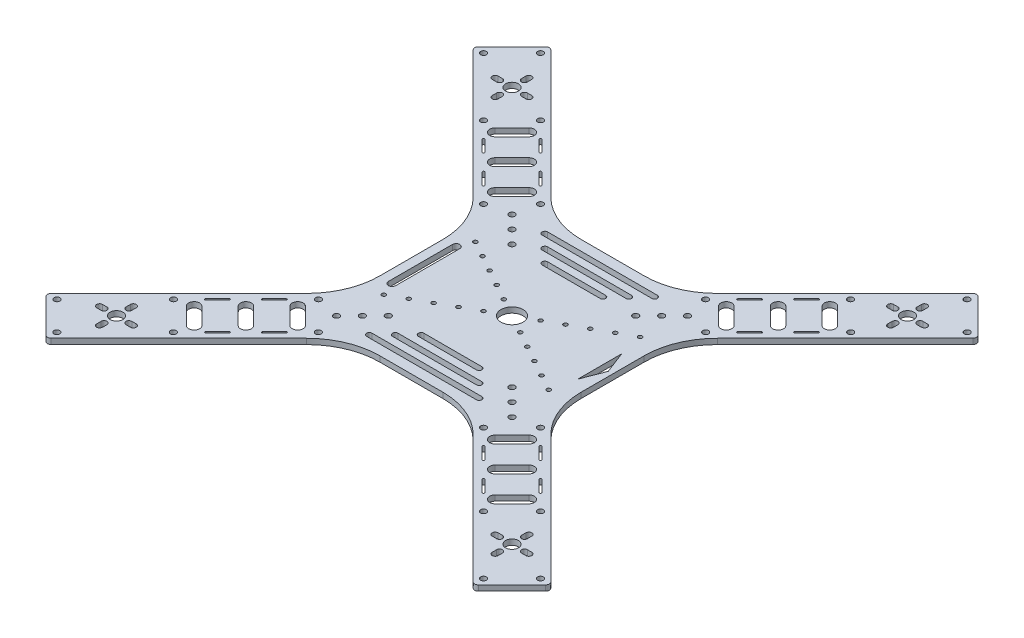
from build123d import *

# Parameters (mm, degrees)
SKETCH_1_R      = 1.6
SKETCH_1_R_2    = 3.5
SKETCH_1_R_3    = 1.1
SKETCH_1_R_4    = 6
EXTRUDE_2_DEPTH = 3
FILLET_1_R      = 2
FILLET_2_R      = 2


with BuildPart() as part:
    # 草图1 → 凸台-拉伸2 (new body)
    with BuildSketch(Plane(origin=(0, 0, 0), x_dir=(1, 0, 0), z_dir=(0, 1, 0))):
        with BuildLine():
            Line((17.218254069, 55), (-17.218254069, 55))
            ThreePointArc((-17.218254069, 55), (-32.525591364, 58.0448187), (-45.502525317, 66.715728753))
            Line((-45.502525317, 66.715728753), (-116.672618896, 137.885822331))
            Line((-116.672618896, 137.885822331), (-137.885822331, 116.672618896))
            Line((-137.885822331, 116.672618896), (-66.715728753, 45.502525317))
            ThreePointArc((-66.715728753, 45.502525317), (-58.0448187, 32.525591364), (-55, 17.218254069))
            Line((-55, 17.218254069), (-55, -17.218254069))
            ThreePointArc((-55, -17.218254069), (-58.0448187, -32.525591364), (-66.715728753, -45.502525317))
            Line((-66.715728753, -45.502525317), (-137.885822331, -116.672618896))
            Line((-137.885822331, -116.672618896), (-116.672618896, -137.885822331))
            Line((-116.672618896, -137.885822331), (-45.502525317, -66.715728753))
            ThreePointArc((-45.502525317, -66.715728753), (-32.525591364, -58.0448187), (-17.218254069, -55))
            Line((-17.218254069, -55), (17.218254069, -55))
            ThreePointArc((17.218254069, -55), (32.525591364, -58.0448187), (45.502525317, -66.715728753))
            Line((45.502525317, -66.715728753), (116.672618896, -137.885822331))
            Line((116.672618896, -137.885822331), (137.885822331, -116.672618896))
            Line((137.885822331, -116.672618896), (66.715728753, -45.502525317))
            ThreePointArc((66.715728753, -45.502525317), (58.0448187, -32.525591364), (55, -17.218254069))
            Line((55, -17.218254069), (55, 17.218254069))
            ThreePointArc((55, 17.218254069), (58.0448187, 32.525591364), (66.715728753, 45.502525317))
            Line((66.715728753, 45.502525317), (137.885822331, 116.672618896))
            Line((137.885822331, 116.672618896), (116.672618896, 137.885822331))
            Line((116.672618896, 137.885822331), (45.502525317, 66.715728753))
            ThreePointArc((45.502525317, 66.715728753), (32.525591364, 58.0448187), (17.218254069, 55))
        make_face()
        with Locations((-116.518289963, -132.074639149)):
            Circle(SKETCH_1_R, mode=Mode.SUBTRACT)
        with Locations((-132.074639149, -116.518289963)):
            Circle(SKETCH_1_R, mode=Mode.SUBTRACT)
        with BuildLine():
            ThreePointArc((-106.433008589, -117.233008589), (-108.033008589, -118.833008589), (-109.633008589, -117.233008589))
            Line((-109.633008589, -117.233008589), (-109.633008589, -114.833008589))
            ThreePointArc((-109.633008589, -114.833008589), (-108.033008589, -113.233008589), (-106.433008589, -114.833008589))
            Line((-106.433008589, -114.833008589), (-106.433008589, -117.233008589))
        make_face(mode=Mode.SUBTRACT)
        with BuildLine():
            ThreePointArc((-117.233008589, -109.633008589), (-118.833008589, -108.033008589), (-117.233008589, -106.433008589))
            Line((-117.233008589, -106.433008589), (-114.833008589, -106.433008589))
            ThreePointArc((-114.833008589, -106.433008589), (-113.233008589, -108.033008589), (-114.833008589, -109.633008589))
            Line((-114.833008589, -109.633008589), (-117.233008589, -109.633008589))
        make_face(mode=Mode.SUBTRACT)
        with Locations((-108.033008589, -108.033008589)):
            Circle(SKETCH_1_R_2, mode=Mode.SUBTRACT)
        with BuildLine():
            ThreePointArc((-98.833008589, -106.433008589), (-97.233008589, -108.033008589), (-98.833008589, -109.633008589))
            Line((-98.833008589, -109.633008589), (-101.233008589, -109.633008589))
            ThreePointArc((-101.233008589, -109.633008589), (-102.833008589, -108.033008589), (-101.233008589, -106.433008589))
            Line((-101.233008589, -106.433008589), (-98.833008589, -106.433008589))
        make_face(mode=Mode.SUBTRACT)
        with BuildLine():
            ThreePointArc((-109.633008589, -98.833008589), (-108.033008589, -97.233008589), (-106.433008589, -98.833008589))
            Line((-106.433008589, -98.833008589), (-106.433008589, -101.233008589))
            ThreePointArc((-106.433008589, -101.233008589), (-108.033008589, -102.833008589), (-109.633008589, -101.233008589))
            Line((-109.633008589, -101.233008589), (-109.633008589, -98.833008589))
        make_face(mode=Mode.SUBTRACT)
        with BuildLine():
            ThreePointArc((-80.102290732, -89.294678888), (-80.102290732, -93.537319575), (-84.344931419, -93.537319575))
            Line((-84.344931419, -93.537319575), (-93.537319575, -84.344931419))
            ThreePointArc((-93.537319575, -84.344931419), (-93.537319575, -80.102290732), (-89.294678888, -80.102290732))
            Line((-89.294678888, -80.102290732), (-80.102290732, -89.294678888))
        make_face(mode=Mode.SUBTRACT)
        with Locations((-84.69848481, -100.254833996)):
            Circle(SKETCH_1_R, mode=Mode.SUBTRACT)
        with BuildLine():
            Line((-76.213203436, -91.062445841), (-69.849242405, -84.69848481))
            ThreePointArc((-69.849242405, -84.69848481), (-69.142135624, -84.69848481), (-69.142135624, -85.405591591))
            Line((-69.142135624, -85.405591591), (-75.506096654, -91.769552622))
            ThreePointArc((-75.506096654, -91.769552622), (-76.213203436, -91.769552622), (-76.213203436, -91.062445841))
        make_face(mode=Mode.SUBTRACT)
        with Locations((-100.254833996, -84.69848481)):
            Circle(SKETCH_1_R, mode=Mode.SUBTRACT)
        with BuildLine():
            ThreePointArc((-85.405591591, -69.142135624), (-84.69848481, -69.142135624), (-84.69848481, -69.849242405))
            Line((-84.69848481, -69.849242405), (-91.06244584, -76.213203436))
            ThreePointArc((-91.06244584, -76.213203436), (-91.769552622, -76.213203436), (-91.769552622, -75.506096654))
            Line((-91.769552622, -75.506096654), (-85.405591591, -69.142135624))
        make_face(mode=Mode.SUBTRACT)
        with BuildLine():
            ThreePointArc((-65.960155108, -75.152543264), (-65.960155108, -79.395183951), (-70.202795796, -79.395183951))
            Line((-70.202795796, -79.395183951), (-79.395183951, -70.202795796))
            ThreePointArc((-79.395183951, -70.202795796), (-79.395183951, -65.960155108), (-75.152543264, -65.960155108))
            Line((-75.152543264, -65.960155108), (-65.960155108, -75.152543264))
        make_face(mode=Mode.SUBTRACT)
        with BuildLine():
            Line((-60.656854249, -75.506096654), (-54.292893219, -69.142135624))
            ThreePointArc((-54.292893219, -69.142135624), (-53.585786438, -69.142135624), (-53.585786438, -69.849242405))
            Line((-53.585786438, -69.849242405), (-59.949747468, -76.213203436))
            ThreePointArc((-59.949747468, -76.213203436), (-60.656854249, -76.213203436), (-60.656854249, -75.506096654))
        make_face(mode=Mode.SUBTRACT)
        with BuildLine():
            ThreePointArc((-69.849242405, -53.585786438), (-69.142135624, -53.585786438), (-69.142135624, -54.292893219))
            Line((-69.142135624, -54.292893219), (-75.506096654, -60.656854249))
            ThreePointArc((-75.506096654, -60.656854249), (-76.213203436, -60.656854249), (-76.213203436, -59.949747468))
            Line((-76.213203436, -59.949747468), (-69.849242405, -53.585786438))
        make_face(mode=Mode.SUBTRACT)
        with BuildLine():
            ThreePointArc((-51.818019485, -61.01040764), (-51.818019485, -65.253048327), (-56.060660172, -65.253048327))
            Line((-56.060660172, -65.253048327), (-65.253048327, -56.060660172))
            ThreePointArc((-65.253048327, -56.060660172), (-65.253048327, -51.818019485), (-61.01040764, -51.818019485))
            Line((-61.01040764, -51.818019485), (-56.414213562, -56.414213562))
            Line((-56.414213562, -56.414213562), (-51.818019485, -61.01040764))
        make_face(mode=Mode.SUBTRACT)
        with Locations((-45.100505063, -60.656854249)):
            Circle(SKETCH_1_R, mode=Mode.SUBTRACT)
        with Locations((-60.656854249, -45.100505063)):
            Circle(SKETCH_1_R, mode=Mode.SUBTRACT)
        with Locations((-47.928932188, -47.928932188)):
            Circle(SKETCH_1_R, mode=Mode.SUBTRACT)
        with Locations((-40.857864376, -40.857864376)):
            Circle(SKETCH_1_R, mode=Mode.SUBTRACT)
        with Locations((-44.999999799, -25)):
            Circle(SKETCH_1_R_3, mode=Mode.SUBTRACT)
        with Locations((-36.258427038, -20.143570688)):
            Circle(SKETCH_1_R_3, mode=Mode.SUBTRACT)
        with BuildLine():
            ThreePointArc((-50.041675599, 17.5), (-48.041675599, 19.5), (-46.041675599, 17.5))
            Line((-46.041675599, 17.5), (-46.041675599, 0))
            Line((-46.041675599, 0), (-46.041675599, -17.5))
            ThreePointArc((-46.041675599, -17.5), (-48.041675599, -19.5), (-50.041675599, -17.5))
            Line((-50.041675599, -17.5), (-50.041675599, 17.5))
        make_face(mode=Mode.SUBTRACT)
        with Locations((-33.786796564, -33.786796564)):
            Circle(SKETCH_1_R, mode=Mode.SUBTRACT)
        with Locations((-27.516854277, -15.287141376)):
            Circle(SKETCH_1_R_3, mode=Mode.SUBTRACT)
        with Locations((-18.775281516, -10.430712065)):
            Circle(SKETCH_1_R_3, mode=Mode.SUBTRACT)
        with Locations((-10.033708754, -5.574282753)):
            Circle(SKETCH_1_R_3, mode=Mode.SUBTRACT)
        with BuildLine():
            ThreePointArc((53.585786438, -69.849242405), (53.585786438, -69.142135624), (54.292893219, -69.142135624))
            Line((54.292893219, -69.142135624), (60.656854249, -75.506096654))
            ThreePointArc((60.656854249, -75.506096654), (60.656854249, -76.213203436), (59.949747468, -76.213203436))
            Line((59.949747468, -76.213203436), (53.585786438, -69.849242405))
        make_face(mode=Mode.SUBTRACT)
        with BuildLine():
            ThreePointArc((98.833008589, -109.633008589), (97.233008589, -108.033008589), (98.833008589, -106.433008589))
            Line((98.833008589, -106.433008589), (101.233008589, -106.433008589))
            ThreePointArc((101.233008589, -106.433008589), (102.833008589, -108.033008589), (101.233008589, -109.633008589))
            Line((101.233008589, -109.633008589), (98.833008589, -109.633008589))
        make_face(mode=Mode.SUBTRACT)
        with Locations((116.518289963, -132.074639149)):
            Circle(SKETCH_1_R, mode=Mode.SUBTRACT)
        with BuildLine():
            ThreePointArc((109.633008589, -117.233008589), (108.033008589, -118.833008589), (106.433008589, -117.233008589))
            Line((106.433008589, -117.233008589), (106.433008589, -114.833008589))
            ThreePointArc((106.433008589, -114.833008589), (108.033008589, -113.233008589), (109.633008589, -114.833008589))
            Line((109.633008589, -114.833008589), (109.633008589, -117.233008589))
        make_face(mode=Mode.SUBTRACT)
        with Locations((108.033008589, -108.033008589)):
            Circle(SKETCH_1_R_2, mode=Mode.SUBTRACT)
        with BuildLine():
            ThreePointArc((117.233008589, -106.433008589), (118.833008589, -108.033008589), (117.233008589, -109.633008589))
            Line((117.233008589, -109.633008589), (114.833008589, -109.633008589))
            ThreePointArc((114.833008589, -109.633008589), (113.233008589, -108.033008589), (114.833008589, -106.433008589))
            Line((114.833008589, -106.433008589), (117.233008589, -106.433008589))
        make_face(mode=Mode.SUBTRACT)
        with Locations((132.074639149, -116.518289963)):
            Circle(SKETCH_1_R, mode=Mode.SUBTRACT)
        with Locations((84.69848481, -100.254833996)):
            Circle(SKETCH_1_R, mode=Mode.SUBTRACT)
        with BuildLine():
            ThreePointArc((69.142135624, -85.405591591), (69.142135624, -84.69848481), (69.849242405, -84.69848481))
            Line((69.849242405, -84.69848481), (76.213203436, -91.062445841))
            ThreePointArc((76.213203436, -91.062445841), (76.213203436, -91.769552622), (75.506096654, -91.769552622))
            Line((75.506096654, -91.769552622), (69.142135624, -85.405591591))
        make_face(mode=Mode.SUBTRACT)
        with BuildLine():
            ThreePointArc((89.294678888, -80.102290732), (93.537319575, -80.102290732), (93.537319575, -84.344931419))
            Line((93.537319575, -84.344931419), (84.344931419, -93.537319575))
            ThreePointArc((84.344931419, -93.537319575), (80.102290732, -93.537319575), (80.102290732, -89.294678888))
            Line((80.102290732, -89.294678888), (89.294678888, -80.102290732))
        make_face(mode=Mode.SUBTRACT)
        with BuildLine():
            ThreePointArc((75.152543264, -65.960155108), (79.395183951, -65.960155108), (79.395183951, -70.202795796))
            Line((79.395183951, -70.202795796), (70.202795796, -79.395183951))
            ThreePointArc((70.202795796, -79.395183951), (65.960155108, -79.395183951), (65.960155108, -75.152543264))
            Line((65.960155108, -75.152543264), (75.152543264, -65.960155108))
        make_face(mode=Mode.SUBTRACT)
        with Locations((100.254833996, -84.69848481)):
            Circle(SKETCH_1_R, mode=Mode.SUBTRACT)
        with BuildLine():
            Line((91.062445841, -76.213203436), (84.69848481, -69.849242405))
            ThreePointArc((84.69848481, -69.849242405), (84.69848481, -69.142135624), (85.405591591, -69.142135624))
            Line((85.405591591, -69.142135624), (91.769552622, -75.506096654))
            ThreePointArc((91.769552622, -75.506096654), (91.769552622, -76.213203436), (91.062445841, -76.213203436))
        make_face(mode=Mode.SUBTRACT)
        with BuildLine():
            ThreePointArc((106.433008589, -98.833008589), (108.033008589, -97.233008589), (109.633008589, -98.833008589))
            Line((109.633008589, -98.833008589), (109.633008589, -101.233008589))
            ThreePointArc((109.633008589, -101.233008589), (108.033008589, -102.833008589), (106.433008589, -101.233008589))
            Line((106.433008589, -101.233008589), (106.433008589, -98.833008589))
        make_face(mode=Mode.SUBTRACT)
        with BuildLine():
            Line((30, -49.428932188), (-30, -49.428932188))
            ThreePointArc((-30, -49.428932188), (-31.5, -47.928932188), (-30, -46.428932188))
            Line((-30, -46.428932188), (30, -46.428932188))
            ThreePointArc((30, -46.428932188), (31.5, -47.928932188), (30, -49.428932188))
        make_face(mode=Mode.SUBTRACT)
        with BuildLine():
            Line((22.928932188, -42.357864376), (-22.928932188, -42.357864376))
            ThreePointArc((-22.928932188, -42.357864376), (-24.428932188, -40.857864376), (-22.928932188, -39.357864376))
            Line((-22.928932188, -39.357864376), (22.928932188, -39.357864376))
            ThreePointArc((22.928932188, -39.357864376), (24.428932188, -40.857864376), (22.928932188, -42.357864376))
        make_face(mode=Mode.SUBTRACT)
        with Locations((45.100505063, -60.656854249)):
            Circle(SKETCH_1_R, mode=Mode.SUBTRACT)
        with BuildLine():
            ThreePointArc((61.01040764, -51.818019485), (65.253048327, -51.818019485), (65.253048327, -56.060660172))
            Line((65.253048327, -56.060660172), (56.060660172, -65.253048327))
            ThreePointArc((56.060660172, -65.253048327), (51.818019485, -65.253048327), (51.818019485, -61.01040764))
            Line((51.818019485, -61.01040764), (56.414213562, -56.414213562))
            Line((56.414213562, -56.414213562), (61.01040764, -51.818019485))
        make_face(mode=Mode.SUBTRACT)
        with Locations((47.928932188, -47.928932188)):
            Circle(SKETCH_1_R, mode=Mode.SUBTRACT)
        with Locations((40.857864376, -40.857864376)):
            Circle(SKETCH_1_R, mode=Mode.SUBTRACT)
        with Locations((60.656854249, -45.100505063)):
            Circle(SKETCH_1_R, mode=Mode.SUBTRACT)
        with BuildLine():
            Line((15.857864376, -35.286796564), (-15.857864376, -35.286796564))
            ThreePointArc((-15.857864376, -35.286796564), (-17.357864376, -33.786796564), (-15.857864376, -32.286796564))
            Line((-15.857864376, -32.286796564), (15.857864376, -32.286796564))
            ThreePointArc((15.857864376, -32.286796564), (17.357864376, -33.786796564), (15.857864376, -35.286796564))
        make_face(mode=Mode.SUBTRACT)
        with Locations((33.786796564, -33.786796564)):
            Circle(SKETCH_1_R, mode=Mode.SUBTRACT)
        Circle(SKETCH_1_R_4, mode=Mode.SUBTRACT)
        with Locations((10.033709156, -5.574282753)):
            Circle(SKETCH_1_R_3, mode=Mode.SUBTRACT)
        with Locations((18.775281917, -10.430712065)):
            Circle(SKETCH_1_R_3, mode=Mode.SUBTRACT)
        with Locations((27.516854678, -15.287141376)):
            Circle(SKETCH_1_R_3, mode=Mode.SUBTRACT)
        with Locations((36.258427439, -20.143570688)):
            Circle(SKETCH_1_R_3, mode=Mode.SUBTRACT)
        with Locations((45.000000201, -25)):
            Circle(SKETCH_1_R_3, mode=Mode.SUBTRACT)
        Polygon((47.928932188, -12), (47.928932188, 12), (52.541676, 0), align=None, mode=Mode.SUBTRACT)
        with BuildLine():
            Line((75.506096654, -60.656854249), (69.142135624, -54.292893219))
            ThreePointArc((69.142135624, -54.292893219), (69.142135624, -53.585786438), (69.849242405, -53.585786438))
            Line((69.849242405, -53.585786438), (76.213203436, -59.949747468))
            ThreePointArc((76.213203436, -59.949747468), (76.213203436, -60.656854249), (75.506096654, -60.656854249))
        make_face(mode=Mode.SUBTRACT)
        with BuildLine():
            Line((-75.506096654, 60.656854249), (-69.142135624, 54.292893219))
            ThreePointArc((-69.142135624, 54.292893219), (-69.142135624, 53.585786438), (-69.849242405, 53.585786438))
            Line((-69.849242405, 53.585786438), (-76.213203436, 59.949747468))
            ThreePointArc((-76.213203436, 59.949747468), (-76.213203436, 60.656854249), (-75.506096654, 60.656854249))
        make_face(mode=Mode.SUBTRACT)
        with Locations((-44.999999799, 25)):
            Circle(SKETCH_1_R_3, mode=Mode.SUBTRACT)
        with Locations((-36.258427038, 20.143570688)):
            Circle(SKETCH_1_R_3, mode=Mode.SUBTRACT)
        with Locations((-27.516854277, 15.287141376)):
            Circle(SKETCH_1_R_3, mode=Mode.SUBTRACT)
        with Locations((-18.775281516, 10.430712065)):
            Circle(SKETCH_1_R_3, mode=Mode.SUBTRACT)
        with Locations((-10.033708754, 5.574282753)):
            Circle(SKETCH_1_R_3, mode=Mode.SUBTRACT)
        with Locations((-33.786796564, 33.786796564)):
            Circle(SKETCH_1_R, mode=Mode.SUBTRACT)
        with Locations((-60.656854249, 45.100505063)):
            Circle(SKETCH_1_R, mode=Mode.SUBTRACT)
        with Locations((-40.857864376, 40.857864376)):
            Circle(SKETCH_1_R, mode=Mode.SUBTRACT)
        with Locations((-47.928932188, 47.928932188)):
            Circle(SKETCH_1_R, mode=Mode.SUBTRACT)
        with BuildLine():
            ThreePointArc((-61.01040764, 51.818019485), (-65.253048327, 51.818019485), (-65.253048327, 56.060660172))
            Line((-65.253048327, 56.060660172), (-56.060660172, 65.253048327))
            ThreePointArc((-56.060660172, 65.253048327), (-51.818019485, 65.253048327), (-51.818019485, 61.01040764))
            Line((-51.818019485, 61.01040764), (-56.414213562, 56.414213562))
            Line((-56.414213562, 56.414213562), (-61.01040764, 51.818019485))
        make_face(mode=Mode.SUBTRACT)
        with Locations((-45.100505063, 60.656854249)):
            Circle(SKETCH_1_R, mode=Mode.SUBTRACT)
        with BuildLine():
            ThreePointArc((-106.433008589, 98.833008589), (-108.033008589, 97.233008589), (-109.633008589, 98.833008589))
            Line((-109.633008589, 98.833008589), (-109.633008589, 101.233008589))
            ThreePointArc((-109.633008589, 101.233008589), (-108.033008589, 102.833008589), (-106.433008589, 101.233008589))
            Line((-106.433008589, 101.233008589), (-106.433008589, 98.833008589))
        make_face(mode=Mode.SUBTRACT)
        with BuildLine():
            Line((-91.062445841, 76.213203436), (-84.69848481, 69.849242405))
            ThreePointArc((-84.69848481, 69.849242405), (-84.69848481, 69.142135624), (-85.405591591, 69.142135624))
            Line((-85.405591591, 69.142135624), (-91.769552622, 75.506096654))
            ThreePointArc((-91.769552622, 75.506096654), (-91.769552622, 76.213203436), (-91.062445841, 76.213203436))
        make_face(mode=Mode.SUBTRACT)
        with Locations((-100.254833996, 84.69848481)):
            Circle(SKETCH_1_R, mode=Mode.SUBTRACT)
        with BuildLine():
            ThreePointArc((-75.152543264, 65.960155108), (-79.395183951, 65.960155108), (-79.395183951, 70.202795796))
            Line((-79.395183951, 70.202795796), (-70.202795796, 79.395183951))
            ThreePointArc((-70.202795796, 79.395183951), (-65.960155108, 79.395183951), (-65.960155108, 75.152543264))
            Line((-65.960155108, 75.152543264), (-75.152543264, 65.960155108))
        make_face(mode=Mode.SUBTRACT)
        with BuildLine():
            ThreePointArc((-89.294678888, 80.102290732), (-93.537319575, 80.102290732), (-93.537319575, 84.344931419))
            Line((-93.537319575, 84.344931419), (-84.344931419, 93.537319575))
            ThreePointArc((-84.344931419, 93.537319575), (-80.102290732, 93.537319575), (-80.102290732, 89.294678888))
            Line((-80.102290732, 89.294678888), (-89.294678888, 80.102290732))
        make_face(mode=Mode.SUBTRACT)
        with BuildLine():
            ThreePointArc((-69.142135624, 85.405591591), (-69.142135624, 84.69848481), (-69.849242405, 84.69848481))
            Line((-69.849242405, 84.69848481), (-76.213203436, 91.062445841))
            ThreePointArc((-76.213203436, 91.062445841), (-76.213203436, 91.769552622), (-75.506096654, 91.769552622))
            Line((-75.506096654, 91.769552622), (-69.142135624, 85.405591591))
        make_face(mode=Mode.SUBTRACT)
        with Locations((-84.69848481, 100.254833996)):
            Circle(SKETCH_1_R, mode=Mode.SUBTRACT)
        with Locations((-132.074639149, 116.518289963)):
            Circle(SKETCH_1_R, mode=Mode.SUBTRACT)
        with BuildLine():
            ThreePointArc((-117.233008589, 106.433008589), (-118.833008589, 108.033008589), (-117.233008589, 109.633008589))
            Line((-117.233008589, 109.633008589), (-114.833008589, 109.633008589))
            ThreePointArc((-114.833008589, 109.633008589), (-113.233008589, 108.033008589), (-114.833008589, 106.433008589))
            Line((-114.833008589, 106.433008589), (-117.233008589, 106.433008589))
        make_face(mode=Mode.SUBTRACT)
        with Locations((-108.033008589, 108.033008589)):
            Circle(SKETCH_1_R_2, mode=Mode.SUBTRACT)
        with BuildLine():
            ThreePointArc((-109.633008589, 117.233008589), (-108.033008589, 118.833008589), (-106.433008589, 117.233008589))
            Line((-106.433008589, 117.233008589), (-106.433008589, 114.833008589))
            ThreePointArc((-106.433008589, 114.833008589), (-108.033008589, 113.233008589), (-109.633008589, 114.833008589))
            Line((-109.633008589, 114.833008589), (-109.633008589, 117.233008589))
        make_face(mode=Mode.SUBTRACT)
        with Locations((-116.518289963, 132.074639149)):
            Circle(SKETCH_1_R, mode=Mode.SUBTRACT)
        with BuildLine():
            ThreePointArc((-98.833008589, 109.633008589), (-97.233008589, 108.033008589), (-98.833008589, 106.433008589))
            Line((-98.833008589, 106.433008589), (-101.233008589, 106.433008589))
            ThreePointArc((-101.233008589, 106.433008589), (-102.833008589, 108.033008589), (-101.233008589, 109.633008589))
            Line((-101.233008589, 109.633008589), (-98.833008589, 109.633008589))
        make_face(mode=Mode.SUBTRACT)
        with BuildLine():
            ThreePointArc((-53.585786438, 69.849242405), (-53.585786438, 69.142135624), (-54.292893219, 69.142135624))
            Line((-54.292893219, 69.142135624), (-60.656854249, 75.506096654))
            ThreePointArc((-60.656854249, 75.506096654), (-60.656854249, 76.213203436), (-59.949747468, 76.213203436))
            Line((-59.949747468, 76.213203436), (-53.585786438, 69.849242405))
        make_face(mode=Mode.SUBTRACT)
        with Locations((10.033709156, 5.574282753)):
            Circle(SKETCH_1_R_3, mode=Mode.SUBTRACT)
        with Locations((18.775281917, 10.430712065)):
            Circle(SKETCH_1_R_3, mode=Mode.SUBTRACT)
        with Locations((27.516854678, 15.287141376)):
            Circle(SKETCH_1_R_3, mode=Mode.SUBTRACT)
        with BuildLine():
            ThreePointArc((-15.857864376, 32.286796564), (-16.918524548, 32.726136393), (-17.357864376, 33.786796564))
            ThreePointArc((-17.357864376, 33.786796564), (-16.918524548, 34.847456736), (-15.857864376, 35.286796564))
            Line((-15.857864376, 35.286796564), (15.857864376, 35.286796564))
            ThreePointArc((15.857864376, 35.286796564), (16.918524548, 34.847456736), (17.357864376, 33.786796564))
            ThreePointArc((17.357864376, 33.786796564), (16.918524548, 32.726136393), (15.857864376, 32.286796564))
            Line((15.857864376, 32.286796564), (-15.857864376, 32.286796564))
        make_face(mode=Mode.SUBTRACT)
        with BuildLine():
            ThreePointArc((35.386796564, 33.786796564), (33.786796564, 32.186796564), (32.186796564, 33.786796564))
            ThreePointArc((32.186796564, 33.786796564), (33.786796564, 35.386796564), (35.386796564, 33.786796564))
        make_face(mode=Mode.SUBTRACT)
        with Locations((36.258427439, 20.143570688)):
            Circle(SKETCH_1_R_3, mode=Mode.SUBTRACT)
        with Locations((45.000000201, 25)):
            Circle(SKETCH_1_R_3, mode=Mode.SUBTRACT)
        with BuildLine():
            ThreePointArc((-22.928932188, 39.357864376), (-23.98959236, 39.797204204), (-24.428932188, 40.857864376))
            ThreePointArc((-24.428932188, 40.857864376), (-23.98959236, 41.918524548), (-22.928932188, 42.357864376))
            Line((-22.928932188, 42.357864376), (22.928932188, 42.357864376))
            ThreePointArc((22.928932188, 42.357864376), (23.98959236, 41.918524548), (24.428932188, 40.857864376))
            ThreePointArc((24.428932188, 40.857864376), (23.98959236, 39.797204204), (22.928932188, 39.357864376))
            Line((22.928932188, 39.357864376), (-22.928932188, 39.357864376))
        make_face(mode=Mode.SUBTRACT)
        with BuildLine():
            ThreePointArc((30, 49.428932188), (31.060660172, 48.98959236), (31.5, 47.928932188))
            ThreePointArc((31.5, 47.928932188), (31.060660172, 46.868272016), (30, 46.428932188))
            Line((30, 46.428932188), (-30, 46.428932188))
            ThreePointArc((-30, 46.428932188), (-31.060660172, 46.868272016), (-31.5, 47.928932188))
            ThreePointArc((-31.5, 47.928932188), (-31.060660172, 48.98959236), (-30, 49.428932188))
            Line((-30, 49.428932188), (30, 49.428932188))
        make_face(mode=Mode.SUBTRACT)
        with BuildLine():
            ThreePointArc((42.457864376, 40.857864376), (40.857864376, 39.257864376), (39.257864376, 40.857864376))
            ThreePointArc((39.257864376, 40.857864376), (40.857864376, 42.457864376), (42.457864376, 40.857864376))
        make_face(mode=Mode.SUBTRACT)
        with BuildLine():
            ThreePointArc((46.328932188, 47.928932188), (47.316638696, 49.40713944), (49.060303038, 49.060303038))
            ThreePointArc((49.060303038, 49.060303038), (49.40713944, 48.54122568), (49.528932188, 47.928932188))
            ThreePointArc((49.528932188, 47.928932188), (47.928932188, 46.328932188), (46.328932188, 47.928932188))
        make_face(mode=Mode.SUBTRACT)
        with Locations((60.656854249, 45.100505063)):
            Circle(SKETCH_1_R, mode=Mode.SUBTRACT)
        with Locations((45.100505063, 60.656854249)):
            Circle(SKETCH_1_R, mode=Mode.SUBTRACT)
        with BuildLine():
            Line((61.01040764, 51.818019485), (56.414213562, 56.414213562))
            Line((56.414213562, 56.414213562), (51.818019485, 61.01040764))
            ThreePointArc((51.818019485, 61.01040764), (51.818019485, 65.253048327), (56.060660172, 65.253048327))
            Line((56.060660172, 65.253048327), (65.253048327, 56.060660172))
            ThreePointArc((65.253048327, 56.060660172), (65.253048327, 51.818019485), (61.01040764, 51.818019485))
        make_face(mode=Mode.SUBTRACT)
        with BuildLine():
            ThreePointArc((69.849242405, 53.585786438), (69.142135624, 53.585786438), (69.142135624, 54.292893219))
            Line((69.142135624, 54.292893219), (75.506096654, 60.656854249))
            ThreePointArc((75.506096654, 60.656854249), (76.213203436, 60.656854249), (76.213203436, 59.949747468))
            Line((76.213203436, 59.949747468), (69.849242405, 53.585786438))
        make_face(mode=Mode.SUBTRACT)
        with BuildLine():
            Line((60.656854249, 75.506096654), (54.292893219, 69.142135624))
            ThreePointArc((54.292893219, 69.142135624), (53.585786438, 69.142135624), (53.585786438, 69.849242405))
            Line((53.585786438, 69.849242405), (59.949747468, 76.213203436))
            ThreePointArc((59.949747468, 76.213203436), (60.656854249, 76.213203436), (60.656854249, 75.506096654))
        make_face(mode=Mode.SUBTRACT)
        with BuildLine():
            ThreePointArc((65.960155108, 75.152543264), (65.960155108, 79.395183951), (70.202795796, 79.395183951))
            Line((70.202795796, 79.395183951), (79.395183951, 70.202795796))
            ThreePointArc((79.395183951, 70.202795796), (79.395183951, 65.960155108), (75.152543264, 65.960155108))
            Line((75.152543264, 65.960155108), (65.960155108, 75.152543264))
        make_face(mode=Mode.SUBTRACT)
        with BuildLine():
            ThreePointArc((85.405591591, 69.142135624), (84.69848481, 69.142135624), (84.69848481, 69.849242405))
            Line((84.69848481, 69.849242405), (91.062445841, 76.213203436))
            ThreePointArc((91.062445841, 76.213203436), (91.769552622, 76.213203436), (91.769552622, 75.506096654))
            Line((91.769552622, 75.506096654), (85.405591591, 69.142135624))
        make_face(mode=Mode.SUBTRACT)
        with Locations((100.254833996, 84.69848481)):
            Circle(SKETCH_1_R, mode=Mode.SUBTRACT)
        with BuildLine():
            Line((76.213203436, 91.062445841), (69.849242405, 84.69848481))
            ThreePointArc((69.849242405, 84.69848481), (69.142135624, 84.69848481), (69.142135624, 85.405591591))
            Line((69.142135624, 85.405591591), (75.506096654, 91.769552622))
            ThreePointArc((75.506096654, 91.769552622), (76.213203436, 91.769552622), (76.213203436, 91.062445841))
        make_face(mode=Mode.SUBTRACT)
        with Locations((84.69848481, 100.254833996)):
            Circle(SKETCH_1_R, mode=Mode.SUBTRACT)
        with BuildLine():
            ThreePointArc((80.102290732, 89.294678888), (80.102290732, 93.537319575), (84.344931419, 93.537319575))
            Line((84.344931419, 93.537319575), (93.537319575, 84.344931419))
            ThreePointArc((93.537319575, 84.344931419), (93.537319575, 80.102290732), (89.294678888, 80.102290732))
            Line((89.294678888, 80.102290732), (80.102290732, 89.294678888))
        make_face(mode=Mode.SUBTRACT)
        with BuildLine():
            ThreePointArc((109.633008589, 98.833008589), (108.033008589, 97.233008589), (106.433008589, 98.833008589))
            Line((106.433008589, 98.833008589), (106.433008589, 101.233008589))
            ThreePointArc((106.433008589, 101.233008589), (108.033008589, 102.833008589), (109.633008589, 101.233008589))
            Line((109.633008589, 101.233008589), (109.633008589, 98.833008589))
        make_face(mode=Mode.SUBTRACT)
        with BuildLine():
            ThreePointArc((98.833008589, 106.433008589), (97.233008589, 108.033008589), (98.833008589, 109.633008589))
            Line((98.833008589, 109.633008589), (101.233008589, 109.633008589))
            ThreePointArc((101.233008589, 109.633008589), (102.833008589, 108.033008589), (101.233008589, 106.433008589))
            Line((101.233008589, 106.433008589), (98.833008589, 106.433008589))
        make_face(mode=Mode.SUBTRACT)
        with Locations((108.033008589, 108.033008589)):
            Circle(SKETCH_1_R_2, mode=Mode.SUBTRACT)
        with BuildLine():
            ThreePointArc((117.233008589, 109.633008589), (118.833008589, 108.033008589), (117.233008589, 106.433008589))
            Line((117.233008589, 106.433008589), (114.833008589, 106.433008589))
            ThreePointArc((114.833008589, 106.433008589), (113.233008589, 108.033008589), (114.833008589, 109.633008589))
            Line((114.833008589, 109.633008589), (117.233008589, 109.633008589))
        make_face(mode=Mode.SUBTRACT)
        with BuildLine():
            ThreePointArc((106.433008589, 117.233008589), (108.033008589, 118.833008589), (109.633008589, 117.233008589))
            Line((109.633008589, 117.233008589), (109.633008589, 114.833008589))
            ThreePointArc((109.633008589, 114.833008589), (108.033008589, 113.233008589), (106.433008589, 114.833008589))
            Line((106.433008589, 114.833008589), (106.433008589, 117.233008589))
        make_face(mode=Mode.SUBTRACT)
        with Locations((132.074639149, 116.518289963)):
            Circle(SKETCH_1_R, mode=Mode.SUBTRACT)
        with Locations((116.518289963, 132.074639149)):
            Circle(SKETCH_1_R, mode=Mode.SUBTRACT)
    extrude(amount=EXTRUDE_2_DEPTH)

    # 圆角1
    fillet_1_edges = [part.edges().sort_by_distance(p)[0] for p in [
        (137.885822331, 1.5, -116.672618896),
    ]]
    fillet(fillet_1_edges, radius=FILLET_1_R)

    # 圆角2
    fillet_2_edges = [part.edges().sort_by_distance(p)[0] for p in [
        (-116.672618896, 1.5, -137.885822331),
        (-137.885822331, 1.5, -116.672618896),
        (-137.885822331, 1.5, 116.672618896),
        (-116.672618896, 1.5, 137.885822331),
        (116.672618896, 1.5, 137.885822331),
        (137.885822331, 1.5, 116.672618896),
        (116.672618896, 1.5, -137.885822331),
    ]]
    fillet(fillet_2_edges, radius=FILLET_2_R)


solid = part.part
